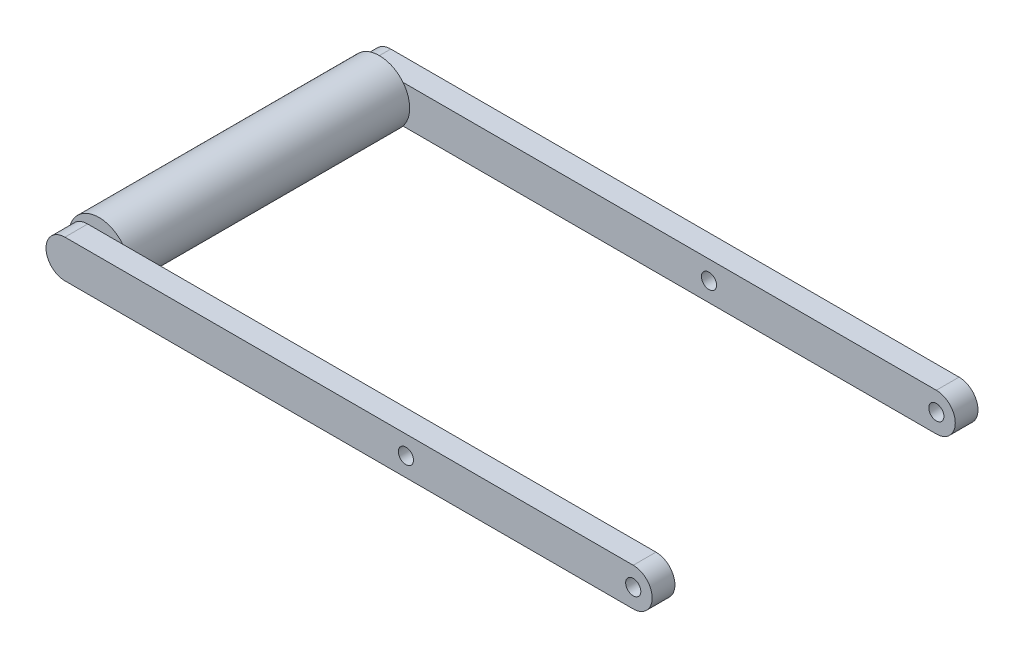
from build123d import *

# Parameters (mm, degrees)
SKETCH1_W                   = 800
SKETCH1_H                   = 50
BOSS_EXTRUDE1_DEPTH         = 30
SKETCH2_R                   = 40
BOSS_EXTRUDE2_DEPTH         = 370
FILLET5_RADIUS              = 25
FILLET5_LENGTH              = 30
FILLET6_R                   = 25
FILLET5_OF_MIRROR3_2_RADIUS = 25
FILLET5_OF_MIRROR3_2_LENGTH = 30
FILLET6_OF_MIRROR3_R        = 25
CUT_EXTRUDE3_DEPTH          = 589.680979382
CUT_EXTRUDE3_DEPTH_BACK     = 589.680979382
SKETCH5_R                   = 10
SKETCH6_R                   = 10
CUT_EXTRUDE4_DEPTH          = 589.680979382


with BuildPart() as part:
    # Sketch1 → Boss-Extrude1 (new body)
    with BuildSketch(Plane.XY):
        Rectangle(SKETCH1_W, SKETCH1_H)
    boss_extrude1 = extrude(amount=BOSS_EXTRUDE1_DEPTH)

    # Sketch2 → Boss-Extrude2 (add)
    with BuildSketch(Plane.XY.offset(30)):
        with Locations(Location((-360.056615351, 0, 0), (0, 0, 176.951220784))):
            Circle(SKETCH2_R)
    extrude(amount=BOSS_EXTRUDE2_DEPTH)

    # Fillet5: full round fillet: the end face becomes a half cylinder, R = half its width
    fillet5_face = Plane((400, 0, 15), x_dir=(0, 0, -1), z_dir=(1, 0, 0))  # on the end face: x along it, z out of the body
    fillet5_slab = fillet5_face.offset(-FILLET5_RADIUS / 2) * Box(FILLET5_LENGTH, 2 * FILLET5_RADIUS, FILLET5_RADIUS, mode=Mode.PRIVATE)  # the body's end, R deep
    fillet5_round = Plane((375, 0, 15), x_dir=(1, 0, 0), z_dir=(0, 0, -1)) * Cylinder(FILLET5_RADIUS, FILLET5_LENGTH, mode=Mode.PRIVATE)  # its axis R under the face
    add(fillet5_slab - fillet5_round, mode=Mode.SUBTRACT)

    # Fillet6
    # the kernel refuses this fillet: 25 mm, written as the material it takes off along each edge
    with BuildSketch(Plane(origin=(-400, -25, -62.5), x_dir=(0, 1, 0), z_dir=(0, 0, 1)), Plane(origin=(-400, 25, -62.5), x_dir=(1, 0, 0), z_dir=(0, 0, 1))) as fillet6_piece_1:
        with BuildLine():
            CenterArc((FILLET6_R, -FILLET6_R), FILLET6_R, 90, 90)
            Line((0, -FILLET6_R), (0, 0))
            Line((0, 0), (FILLET6_R, 0))
        make_face()
    extrude(amount=92.5, mode=Mode.SUBTRACT)

    # Mirror3: Boss-Extrude1 across plane
    add(boss_extrude1.mirror(Plane.XY.offset(215)))

    # Fillet5 of Mirror3 2: full round fillet: the end face becomes a half cylinder, R = half its width
    fillet5_of_mirror3_2_face = Plane((400, 0, 415), x_dir=(0, 0, 1), z_dir=(1, 0, 0))  # on the end face: x along it, z out of the body
    fillet5_of_mirror3_2_slab = fillet5_of_mirror3_2_face.offset(-FILLET5_OF_MIRROR3_2_RADIUS / 2) * Box(FILLET5_OF_MIRROR3_2_LENGTH, 2 * FILLET5_OF_MIRROR3_2_RADIUS, FILLET5_OF_MIRROR3_2_RADIUS, mode=Mode.PRIVATE)  # the body's end, R deep
    fillet5_of_mirror3_2_round = Plane((375, 0, 415), x_dir=(1, 0, 0), z_dir=(0, 0, 1)) * Cylinder(FILLET5_OF_MIRROR3_2_RADIUS, FILLET5_OF_MIRROR3_2_LENGTH, mode=Mode.PRIVATE)  # its axis R under the face
    add(fillet5_of_mirror3_2_slab - fillet5_of_mirror3_2_round, mode=Mode.SUBTRACT)

    # Fillet6 of Mirror3
    # the kernel refuses this fillet: 25 mm, written as the material it takes off along each edge
    with BuildSketch(Plane(origin=(-400, -25, 492.5), x_dir=(0, 1, 0), z_dir=(0, 0, -1))) as fillet6_of_mirror3_piece_1:
        with BuildLine():
            CenterArc((FILLET6_OF_MIRROR3_R, FILLET6_OF_MIRROR3_R), FILLET6_OF_MIRROR3_R, 180, 90)
            Line((0, FILLET6_OF_MIRROR3_R), (0, 0))
            Line((0, 0), (FILLET6_OF_MIRROR3_R, 0))
        make_face()
    extrude(amount=92.5, mode=Mode.SUBTRACT)
    with BuildSketch(Plane(origin=(-400, 25, 492.5), x_dir=(0, -1, 0), z_dir=(0, 0, -1))) as fillet6_of_mirror3_piece_2:
        with BuildLine():
            CenterArc((FILLET6_OF_MIRROR3_R, -FILLET6_OF_MIRROR3_R), FILLET6_OF_MIRROR3_R, 90, 90)
            Line((0, -FILLET6_OF_MIRROR3_R), (0, 0))
            Line((0, 0), (FILLET6_OF_MIRROR3_R, 0))
        make_face()
    extrude(amount=92.5, mode=Mode.SUBTRACT)

    # Sketch5 → Cut-Extrude3 (cut, two sides: drawn at the far end of the back side and taken through both)
    with BuildSketch(Plane.XY.offset(430).offset(-CUT_EXTRUDE3_DEPTH_BACK)):
        with Locations(Location((75, 0, 0), (0, 0, 180))):
            Circle(SKETCH5_R)
    extrude(amount=CUT_EXTRUDE3_DEPTH + CUT_EXTRUDE3_DEPTH_BACK, mode=Mode.SUBTRACT)

    # Sketch6 → Cut-Extrude4 (cut, through all)
    with BuildSketch(Plane.XY.offset(430)):
        with Locations((375, 0)):
            Circle(SKETCH6_R)
    extrude(amount=-CUT_EXTRUDE4_DEPTH, mode=Mode.SUBTRACT)


solid = part.part
